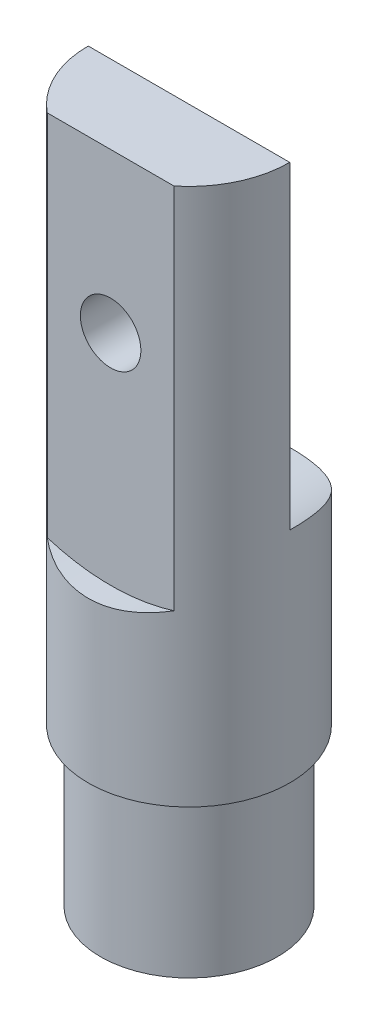
from build123d import *

# Parameters (mm, degrees)
SKETCH1_R           = 4.5
BOSS_EXTRUDE1_DEPTH = 24
SKETCH2_R           = 3.9
BOSS_EXTRUDE2_DEPTH = 7
CUT_EXTRUDE6_START  = -7
SKETCH7_R           = 3.9
CUT_EXTRUDE6_DEPTH  = 7
SKETCH6_R           = 3.95
BOSS_EXTRUDE3_DEPTH = 7
SKETCH15_R          = 2.5
CUT_EXTRUDE18_DEPTH = 9
CUT_EXTRUDE14_START = -8
CUT_EXTRUDE14_DEPTH = 8
SKETCH12_R          = 1.35
CUT_EXTRUDE15_DEPTH = 25.829418036
SKETCH13_R          = 8.42604424
CUT_EXTRUDE16_DEPTH = 8
SKETCH14_R          = 9.45134593
CUT_EXTRUDE17_DEPTH = 8
SKETCH16_W          = 5.634715958
SKETCH16_H          = 5.53714512
SKETCH16_W_2        = 5.059688512
SKETCH16_H_2        = 4
BOSS_EXTRUDE5_DEPTH = 11


with BuildPart() as part:
    # Sketch1 → Boss-Extrude1 (new body)
    with BuildSketch(Plane(origin=(0, 0, 0), x_dir=(1, 0, 0), z_dir=(0, 1, 0))):
        Circle(SKETCH1_R)
    extrude(amount=BOSS_EXTRUDE1_DEPTH)

    # Sketch2 → Boss-Extrude2 (add)
    with BuildSketch(Plane.XZ):
        Circle(SKETCH2_R)
    extrude(amount=BOSS_EXTRUDE2_DEPTH)

    # Sketch7 → Cut-Extrude6 (cut)
    with BuildSketch(Plane.XZ.offset(7).offset(CUT_EXTRUDE6_START)):
        Circle(SKETCH7_R)
    extrude(amount=CUT_EXTRUDE6_DEPTH, mode=Mode.SUBTRACT)

    # Sketch6 → Boss-Extrude3 (add)
    with BuildSketch(Plane.XZ.offset(7)):
        Circle(SKETCH6_R)
    extrude(amount=-BOSS_EXTRUDE3_DEPTH)

    # Sketch15 → Cut-Extrude18 (cut)
    with BuildSketch(Plane.XZ.offset(7)):
        Circle(SKETCH15_R)
    extrude(amount=-CUT_EXTRUDE18_DEPTH, mode=Mode.SUBTRACT)

    # Sketch11 → Cut-Extrude14 (cut)
    with BuildSketch(Plane(origin=(0, 24, 0), x_dir=(1, 0, 0), z_dir=(0, 1, 0)).offset(CUT_EXTRUDE14_START)):
        with BuildLine():
            Line((-4.5, 0), (4.5, 0))
            ThreePointArc((4.5, 0), (0, 4.5), (-4.5, 0))
        make_face()
        with BuildLine():
            Line((-2.828427125, -3.5), (2.828427125, -3.5))
            ThreePointArc((2.828427125, -3.5), (0, -4.5), (-2.828427125, -3.5))
        make_face()
    extrude(amount=CUT_EXTRUDE14_DEPTH, mode=Mode.SUBTRACT)

    # Sketch12 → Cut-Extrude15 (cut, through all)
    with BuildSketch(Plane(origin=(0, 0, 0), x_dir=(-1, 0, 0), z_dir=(0, 0, -1))):
        with Locations((0, 16.90155662)):
            Circle(SKETCH12_R)
    extrude(amount=-CUT_EXTRUDE15_DEPTH, mode=Mode.SUBTRACT)

    # Sketch13 → Cut-Extrude16 (cut)
    with BuildSketch(Plane(origin=(0, 0, 0), x_dir=(-1, 0, 0), z_dir=(0, 0, -1))):
        with Locations((0, 16.90155662)):
            Circle(SKETCH13_R)
    extrude(amount=CUT_EXTRUDE16_DEPTH, mode=Mode.SUBTRACT)

    # Sketch14 → Cut-Extrude17 (cut)
    with BuildSketch(Plane.XY.offset(3.5)):
        with Locations((0, 16.591485995)):
            Circle(SKETCH14_R)
    extrude(amount=CUT_EXTRUDE17_DEPTH, mode=Mode.SUBTRACT)

    # Sketch16 → Boss-Extrude5 (add)
    with BuildSketch(Plane.XZ.offset(7)):
        Rectangle(SKETCH16_W, SKETCH16_H)
        Rectangle(SKETCH16_W_2, SKETCH16_H_2, mode=Mode.SUBTRACT)
    extrude(amount=-BOSS_EXTRUDE5_DEPTH)


solid = part.part
